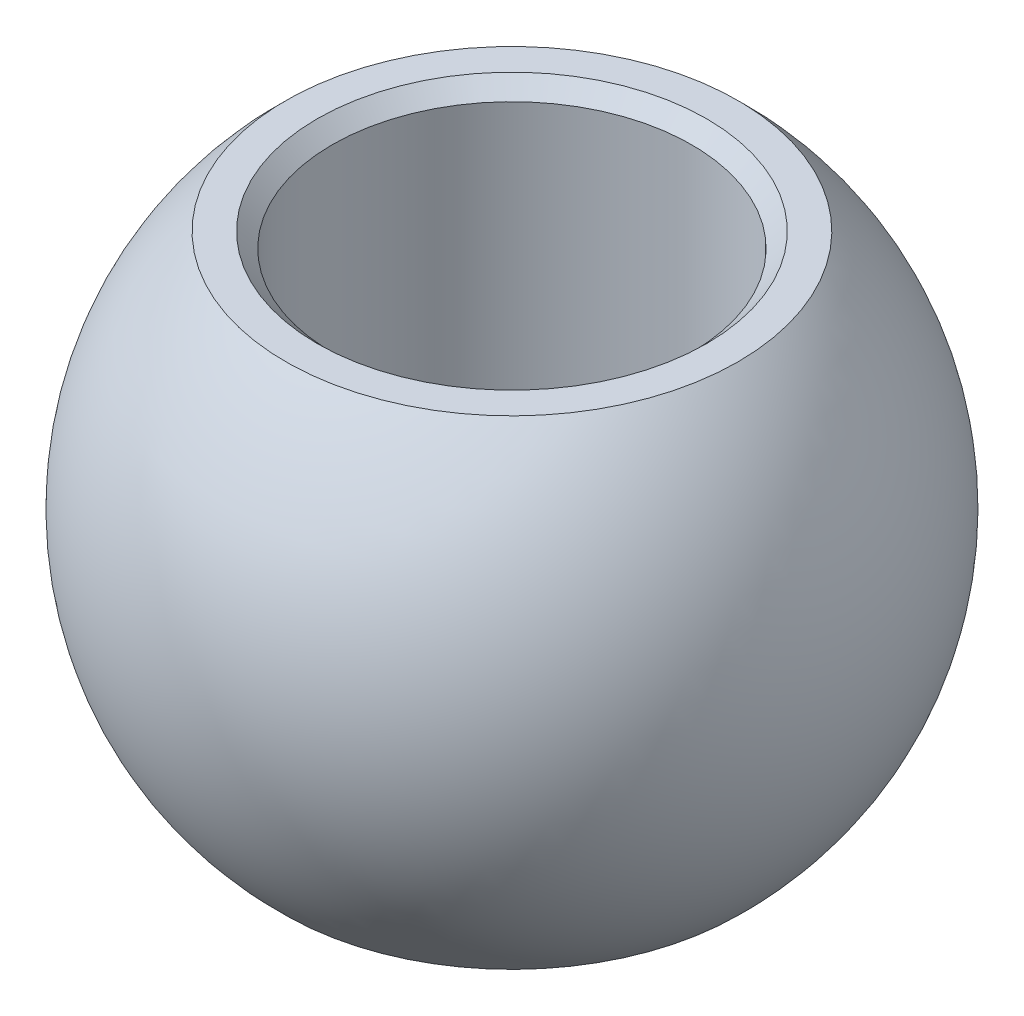
from build123d import *
from build123d.topology import SkipClean

# Parameters (mm, degrees)
CUT_EXTRUDE1_START     = -7.549834435
CUT_EXTRUDE1_OUTLINE_W = 18
CUT_EXTRUDE1_OUTLINE_H = 4
CUT_EXTRUDE1_DEPTH     = 15.09966887
SKETCH3_R              = 6
CUT_EXTRUDE2_DEPTH     = 57
CHAMFER1_SIZE          = 0.5
SCALE1_SCALE           = 0.666666667


# Read off the part's stored shape, not the designer's step: Cut-Extrude1
with BuildPart() as part:
    # Sketch1 → Revolve1 (revolve)
    with SkipClean():  # the faces are left unmerged after this step: merging them gives an invalid solid
        with BuildSketch(Plane.XY):
            with BuildLine():
                ThreePointArc((11, 0), (7.778174593, 7.778174593), (0, 11))
                Line((0, 11), (0, -11))
                ThreePointArc((0, -11), (7.778174593, -7.778174593), (11, 0))
            make_face()
            with BuildLine():
                Line((0, -11), (0, 11))
                ThreePointArc((0, 11), (-11, 0), (0, -11))
            make_face()
        revolve(axis=Axis((0, 11, 0), (0, -1, 0)))

    # Cut-Extrude1 outline → Cut-Extrude1 (cut)
    with BuildSketch(Plane.XY.offset(CUT_EXTRUDE1_START)):
        with Locations((0, 10)):
            Rectangle(CUT_EXTRUDE1_OUTLINE_W, CUT_EXTRUDE1_OUTLINE_H)
        with Locations((0, -10)):
            Rectangle(CUT_EXTRUDE1_OUTLINE_W, CUT_EXTRUDE1_OUTLINE_H)
    extrude(amount=CUT_EXTRUDE1_DEPTH, mode=Mode.SUBTRACT)

    # Sketch3 → Cut-Extrude2 (cut)
    with BuildSketch(Plane(origin=(0, 8, 0), x_dir=(1, 0, 0), z_dir=(0, 1, 0))):
        with Locations(Location((0, 0, 0), (0, 0, 180))):
            Circle(SKETCH3_R)
    extrude(amount=-CUT_EXTRUDE2_DEPTH, mode=Mode.SUBTRACT)

    # Chamfer1
    chamfer1_edges = [part.edges().sort_by_distance(p)[0] for p in [
        (6, -8, 0),
        (6, 8, 0),
    ]]
    chamfer(chamfer1_edges, length=CHAMFER1_SIZE)


with BuildPart() as part_1:
    # Scale1: scaled about (0, 0, 0)
    add(part.part.scale(SCALE1_SCALE))


solid = part_1.part
